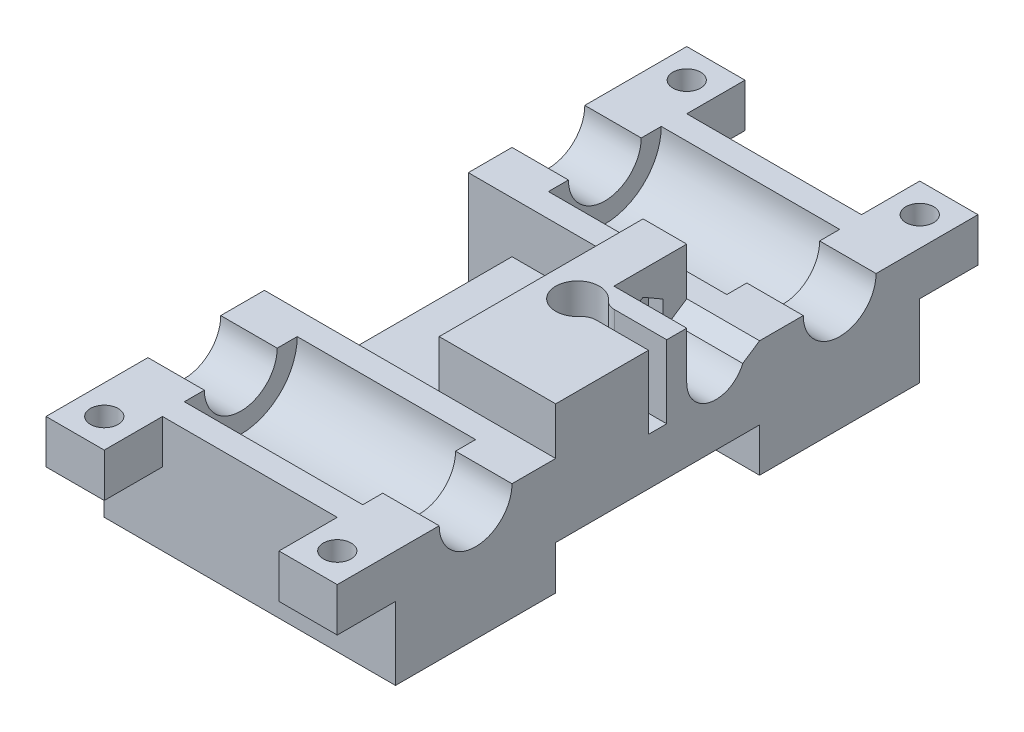
from build123d import *

# Parameters (mm, degrees)
SKETCH1_W                  = 40
SKETCH1_H                  = 22
BOSS_EXTRUDE1_DEPTH        = 11
SKETCH2_W                  = 40
SKETCH2_H                  = 22
SKETCH2_R                  = 7.843750423
BOSS_EXTRUDE2_DEPTH        = 5
SKETCH3_W                  = 24.5
SKETCH3_H                  = 15.5
CUT_EXTRUDE1_DEPTH         = 7.75
FILLET1_R                  = 7.75
SKETCH4_R                  = 5
CUT_EXTRUDE2_DEPTH         = 36.805900352
SKETCH5_W                  = 8
SKETCH5_H                  = 8
SKETCH5_R                  = 1.905800151
BOSS_EXTRUDE3_DEPTH        = 6
CUT_EXTRUDE3_START         = -3
SKETCH6_R                  = 3
SKETCH6_R_2                = 1.905800151
CUT_EXTRUDE3_DEPTH         = 3
SKETCH7_W                  = 16
SKETCH7_H                  = 16.5
BOSS_EXTRUDE5_DEPTH        = 28
MIRROR14_COPY_1_SKETCH_W   = 8
MIRROR14_COPY_1_SKETCH_H   = 8
MIRROR14_COPY_1_SKETCH_R   = 1.905800151
MIRROR14_COPY_1_DEPTH      = 6
MIRROR14_START             = -3
MIRROR14_COPY_2_SKETCH_R   = 3
MIRROR14_COPY_2_SKETCH_R_2 = 1.905800151
MIRROR14_COPY_2_DEPTH      = 3
FILLET1_OF_MIRROR14_R      = 7.75
SKETCH9_W                  = 28
SKETCH9_H                  = 3
BOSS_EXTRUDE6_DEPTH        = 18
CUT_EXTRUDE4_DEPTH         = 10
CUT_EXTRUDE5_DEPTH         = 73.919476136
CUT_EXTRUDE5_DEPTH_BACK    = 73.919476136
SKETCH11_R                 = 1.75
CUT_EXTRUDE6_DEPTH         = 76.121568141
CUT_EXTRUDE6_DEPTH_BACK    = 76.121568141
SKETCH12_R                 = 1.75
CUT_EXTRUDE9_DEPTH         = 12
CUT_EXTRUDE11_START        = -10
SKETCH16_R                 = 4
SKETCH16_R_2               = 1.75
SKETCH16_W                 = 10
SKETCH16_H                 = 6.5
CUT_EXTRUDE11_DEPTH        = 10
FILLET2_R                  = 2


# Some blends are built 0.0001 mm under size
with BuildPart() as part:
    # Sketch1 → Boss-Extrude1 (new body)
    with BuildSketch(Plane(origin=(0, 0, 0), x_dir=(1, 0, 0), z_dir=(0, 1, 0))):
        Rectangle(SKETCH1_W, SKETCH1_H)
    boss_extrude1 = extrude(amount=BOSS_EXTRUDE1_DEPTH)

    # Sketch2 → Boss-Extrude2 (add)
    with BuildSketch(Plane(origin=(0, 0, 0), x_dir=(1, 0, 0), z_dir=(0, 1, 0))):
        Rectangle(SKETCH2_W, SKETCH2_H)
        with Locations(Location((0, 0, 0), (0, 0, 270))):
            Circle(SKETCH2_R, mode=Mode.SUBTRACT)
    boss_extrude2 = extrude(amount=-BOSS_EXTRUDE2_DEPTH)

    # Sketch3 → Cut-Extrude1 (cut)
    with BuildSketch(Plane(origin=(0, 11, 0), x_dir=(1, 0, 0), z_dir=(0, 1, 0))):
        Rectangle(SKETCH3_W, SKETCH3_H)
    cut_extrude1 = extrude(amount=-CUT_EXTRUDE1_DEPTH, mode=Mode.SUBTRACT)

    # Fillet1
    fillet1_edges = [part.edges().sort_by_distance(p)[0] for p in [
        (0, 3.25, 7.75),
        (0, 3.25, -7.75),
    ]]
    fillet(fillet1_edges, radius=FILLET1_R - 0.0001)  # a hair under: the kernel refuses the full size

    # Sketch4 → Cut-Extrude2 (cut, symmetric)
    with BuildSketch(Plane(origin=(-12.25, 0, 0), x_dir=(0, 0, -1), z_dir=(1, 0, 0))):
        with Locations((0, 11)):
            Circle(SKETCH4_R)
    cut_extrude2 = extrude(amount=CUT_EXTRUDE2_DEPTH, both=True, mode=Mode.SUBTRACT)

    # Sketch5 → Boss-Extrude3 (add)
    with BuildSketch(Plane(origin=(0, 11, 0), x_dir=(1, 0, 0), z_dir=(0, 1, 0))):
        with Locations((16, -15)):
            Rectangle(SKETCH5_W, SKETCH5_H)
        with Locations(Location((16, -15, 0), (0, 0, 270))):
            Circle(SKETCH5_R, mode=Mode.SUBTRACT)
    boss_extrude3 = extrude(amount=-BOSS_EXTRUDE3_DEPTH)

    # Sketch6 → Cut-Extrude3 (cut)
    with BuildSketch(Plane.XZ.offset(-5).offset(CUT_EXTRUDE3_START)):
        with Locations(Location((16, 15, 0), (0, 0, 270))):
            Circle(SKETCH6_R)
        with Locations(Location((16, 15, 0), (0, 0, 90))):
            Circle(SKETCH6_R_2, mode=Mode.SUBTRACT)
    cut_extrude3 = extrude(amount=CUT_EXTRUDE3_DEPTH, mode=Mode.SUBTRACT)

    # Mirror8: Boss-Extrude3, Cut-Extrude3 across plane
    add(boss_extrude3.mirror(Plane(origin=(0, 0, 0), x_dir=(0, 0, 1), z_dir=(1, 0, 0))))
    add(cut_extrude3.mirror(Plane(origin=(0, 0, 0), x_dir=(0, 0, 1), z_dir=(1, 0, 0))), mode=Mode.SUBTRACT)

    # Sketch7 → Boss-Extrude5 (add)
    with BuildSketch(Plane(origin=(0, 0, -11), x_dir=(-1, 0, 0), z_dir=(0, 0, -1))):
        with Locations((-12, 9.25)):
            Rectangle(SKETCH7_W, SKETCH7_H)
    extrude(amount=BOSS_EXTRUDE5_DEPTH)

    # Mirror14: Boss-Extrude1, Boss-Extrude2, Cut-Extrude1, Cut-Extrude2, Boss-Extrude3, Cut-Extrude3 across plane
    add(boss_extrude1.mirror(Plane.XY.offset(-25)))
    add(boss_extrude2.mirror(Plane.XY.offset(-25)))
    add(cut_extrude1.mirror(Plane.XY.offset(-25)), mode=Mode.SUBTRACT)
    add(cut_extrude2.mirror(Plane.XY.offset(-25)), mode=Mode.SUBTRACT)
    add(boss_extrude3.mirror(Plane.XY.offset(-25)))
    add(cut_extrude3.mirror(Plane.XY.offset(-25)), mode=Mode.SUBTRACT)

    # Mirror14 copy 1 sketch → Mirror14 copy 1 (add)
    with BuildSketch(Plane(origin=(0, 11, -50), x_dir=(-1, 0, 0), z_dir=(0, 1, 0))):
        with Locations((16, -15)):
            Rectangle(MIRROR14_COPY_1_SKETCH_W, MIRROR14_COPY_1_SKETCH_H)
        with Locations(Location((16, -15, 0), (0, 0, 270))):
            Circle(MIRROR14_COPY_1_SKETCH_R, mode=Mode.SUBTRACT)
    extrude(amount=-MIRROR14_COPY_1_DEPTH)

    # Mirror14 copy 2 sketch → Mirror14 copy 2 (cut)
    with BuildSketch(Plane(origin=(0, 5, -50), x_dir=(-1, 0, 0), z_dir=(0, -1, 0)).offset(MIRROR14_START)):
        with Locations(Location((16, 15, 0), (0, 0, 270))):
            Circle(MIRROR14_COPY_2_SKETCH_R)
        with Locations(Location((16, 15, 0), (0, 0, 90))):
            Circle(MIRROR14_COPY_2_SKETCH_R_2, mode=Mode.SUBTRACT)
    extrude(amount=MIRROR14_COPY_2_DEPTH, mode=Mode.SUBTRACT)

    # Fillet1 of Mirror14
    fillet1_of_mirror14_edges = [part.edges().sort_by_distance(p)[0] for p in [
        (0, 3.25, -57.75),
        (0, 3.25, -42.25),
    ]]
    fillet(fillet1_of_mirror14_edges, radius=FILLET1_OF_MIRROR14_R - 0.0001)  # a hair under: the kernel refuses the full size

    # Sketch9 → Boss-Extrude6 (add)
    with BuildSketch(Plane.ZY.offset(-4)):
        with Locations((-25, 2.5)):
            Rectangle(SKETCH9_W, SKETCH9_H)
    extrude(amount=BOSS_EXTRUDE6_DEPTH)

    # Sketch10 → Cut-Extrude4 (cut)
    with BuildSketch(Plane(origin=(0, 17.5, 0), x_dir=(1, 0, 0), z_dir=(0, 1, 0))):
        with BuildLine():
            Line((9, 26.25), (9, 23.75))
            Line((9, 23.75), (11.727178029, 23.75))
            ThreePointArc((11.727178029, 23.75), (11.931001031, 24.360286817), (12, 25))
            ThreePointArc((12, 25), (11.931001031, 25.639713183), (11.727178029, 26.25))
            Line((11.727178029, 26.25), (9, 26.25))
        make_face()
        with BuildLine():
            Line((11.727178029, 23.75), (9, 23.75))
            Line((9, 23.75), (9, 26.25))
            Line((9, 26.25), (11.727178029, 26.25))
            ThreePointArc((11.727178029, 26.25), (6, 25), (11.727178029, 23.75))
        make_face()
        with BuildLine():
            ThreePointArc((12, 25), (11.931001031, 24.360286817), (11.727178029, 23.75))
            Line((11.727178029, 23.75), (20, 23.75))
            Line((20, 23.75), (20, 26.25))
            Line((20, 26.25), (11.727178029, 26.25))
            ThreePointArc((11.727178029, 26.25), (11.931001031, 25.639713183), (12, 25))
        make_face()
    extrude(amount=-CUT_EXTRUDE4_DEPTH, mode=Mode.SUBTRACT)

    # Sketch11 → Cut-Extrude5 (cut, two sides: drawn at the far end of the back side and taken through both)
    with BuildSketch(Plane(origin=(0, 7.5, 0), x_dir=(1, 0, 0), z_dir=(0, 1, 0)).offset(-CUT_EXTRUDE5_DEPTH_BACK)):
        with Locations(Location((9, 25, 0), (0, 0, 270))):
            Circle(SKETCH11_R)
    extrude(amount=CUT_EXTRUDE5_DEPTH + CUT_EXTRUDE5_DEPTH_BACK, mode=Mode.SUBTRACT)

    # Sketch12 → Cut-Extrude6 (cut, two sides: drawn at the far end of the back side and taken through both)
    with BuildSketch(Plane.ZY.offset(-4).offset(-CUT_EXTRUDE6_DEPTH_BACK)):
        with Locations((-33, 11)):
            Circle(SKETCH12_R)
    extrude(amount=CUT_EXTRUDE6_DEPTH + CUT_EXTRUDE6_DEPTH_BACK, mode=Mode.SUBTRACT)

    # Sketch15 → Cut-Extrude9 (cut)
    with BuildSketch(Plane(origin=(20, 0, 0), x_dir=(0, 0, -1), z_dir=(1, 0, 0))):
        Polygon((33, 14.175426481), (30.25, 12.58771324), (30.25, 9.41228676), (33, 7.824573519), (35.75, 9.41228676), (35.75, 12.58771324), align=None)
    extrude(amount=-CUT_EXTRUDE9_DEPTH, mode=Mode.SUBTRACT)

    # Sketch16 → Cut-Extrude11 (cut)
    # profile 1 of 2: a face of its own
    with BuildSketch(Plane(origin=(20, 0, 0), x_dir=(0, 0, -1), z_dir=(1, 0, 0)).offset(CUT_EXTRUDE11_START)):
        with Locations((33, 11)):
            Circle(SKETCH16_R)
        with Locations((33, 11)):
            Circle(SKETCH16_R_2, mode=Mode.SUBTRACT)
    # profile 2 of 2: a face of its own
    with BuildSketch(Plane(origin=(20, 0, 0), x_dir=(0, 0, -1), z_dir=(1, 0, 0)).offset(CUT_EXTRUDE11_START)):
        with Locations((34, 14.25)):
            Rectangle(SKETCH16_W, SKETCH16_H)
    extrude(amount=CUT_EXTRUDE11_DEPTH, mode=Mode.SUBTRACT)

    # Chamfer3
    # the kernel refuses this chamfer: 2.5 mm, written as the material it takes off along each edge
    with BuildSketch(Plane(origin=(4.790141486, 11, -37), x_dir=(0, -0.9712202897009368, 0.23818301550116588), z_dir=(1, 0, 0))) as chamfer3_piece_1_section:
        with BuildLine():
            Line((1.641163776, 0), (-0.550057664, 2.010038976))
            Line((-0.550057664, 2.010038976), (-0.598618679, 1.998129825))
            ThreePointArc((-0.598618679, 1.998129825), (-0.296653042, 0.999716345), (-0.048561014, -0.011909151))
            Line((-0.048561014, -0.011909151), (0.011909151, -0.048561014))
            ThreePointArc((0.011909151, -0.048561014), (0.818444442, 0.062835502), (1.633479525, -0.049405994))
            Line((1.633479525, -0.049405994), (1.641163776, 0))
        make_face()
    chamfer3_piece_1 = extrude(amount=20.419717028, mode=Mode.PRIVATE)
    chamfer3_piece_1 = split(chamfer3_piece_1, bisect_by=Plane(origin=(10, 11.063270064, -39.03704072), z_dir=(-1, 0, 0)), keep=Keep.TOP, mode=Mode.PRIVATE)
    chamfer3_piece_1 = split(chamfer3_piece_1, bisect_by=Plane(origin=(7.395070743, 11.063270064, -39), z_dir=(0, 0, -1)), keep=Keep.TOP, mode=Mode.PRIVATE)
    add(chamfer3_piece_1, mode=Mode.SUBTRACT)
    with BuildSketch(Plane(origin=(10, 11, -37), x_dir=(0, -0.9712202897009377, 0.23818301550116178), z_dir=(1, 0, 0))) as chamfer3_piece_2_section:
        with BuildLine():
            Line((1.641163776, 0), (-0.550057664, 2.010038976))
            Line((-0.550057664, 2.010038976), (-0.598618679, 1.998129825))
            ThreePointArc((-0.598618679, 1.998129825), (-0.296653042, 0.999716345), (-0.048561014, -0.011909151))
            Line((-0.048561014, -0.011909151), (0.011909151, -0.048561014))
            ThreePointArc((0.011909151, -0.048561014), (0.818444442, 0.062835502), (1.633479525, -0.049405994))
            Line((1.633479525, -0.049405994), (1.641163776, 0))
        make_face()
    chamfer3_piece_2 = extrude(amount=15.209858514, mode=Mode.PRIVATE)
    chamfer3_piece_2 = split(chamfer3_piece_2, bisect_by=Plane(origin=(17.604929257, 10.514615405, -39), z_dir=(0, 0, 1)), keep=Keep.TOP, mode=Mode.PRIVATE)
    add(chamfer3_piece_2, mode=Mode.SUBTRACT)
    with BuildSketch(Plane(origin=(10, 11, -37), x_dir=(0, -0.9712202897009377, 0.23818301550116178), z_dir=(1, 0, 0))) as chamfer3_piece_3_section:
        with BuildLine():
            Line((1.641163776, 0), (-0.550057664, 2.010038976))
            Line((-0.550057664, 2.010038976), (-0.598618679, 1.998129825))
            ThreePointArc((-0.598618679, 1.998129825), (-0.296653042, 0.999716345), (-0.048561014, -0.011909151))
            Line((-0.048561014, -0.011909151), (0.011909151, -0.048561014))
            ThreePointArc((0.011909151, -0.048561014), (0.818444442, 0.062835502), (1.633479525, -0.049405994))
            Line((1.633479525, -0.049405994), (1.641163776, 0))
        make_face()
    chamfer3_piece_3 = extrude(amount=15.209858514, mode=Mode.PRIVATE)
    chamfer3_piece_3 = split(chamfer3_piece_3, bisect_by=Plane(origin=(17.604929257, 11.063270064, -39), z_dir=(0, 0, -1)), keep=Keep.TOP, mode=Mode.PRIVATE)
    add(chamfer3_piece_3, mode=Mode.SUBTRACT)

    # Fillet2
    fillet2_edges = [part.edges().sort_by_distance(p)[0] for p in [
        (11.727178029, 12.5, -23.75),
        (11.727178029, 12.5, -26.25),
    ]]
    fillet(fillet2_edges, radius=FILLET2_R)


solid = part.part
